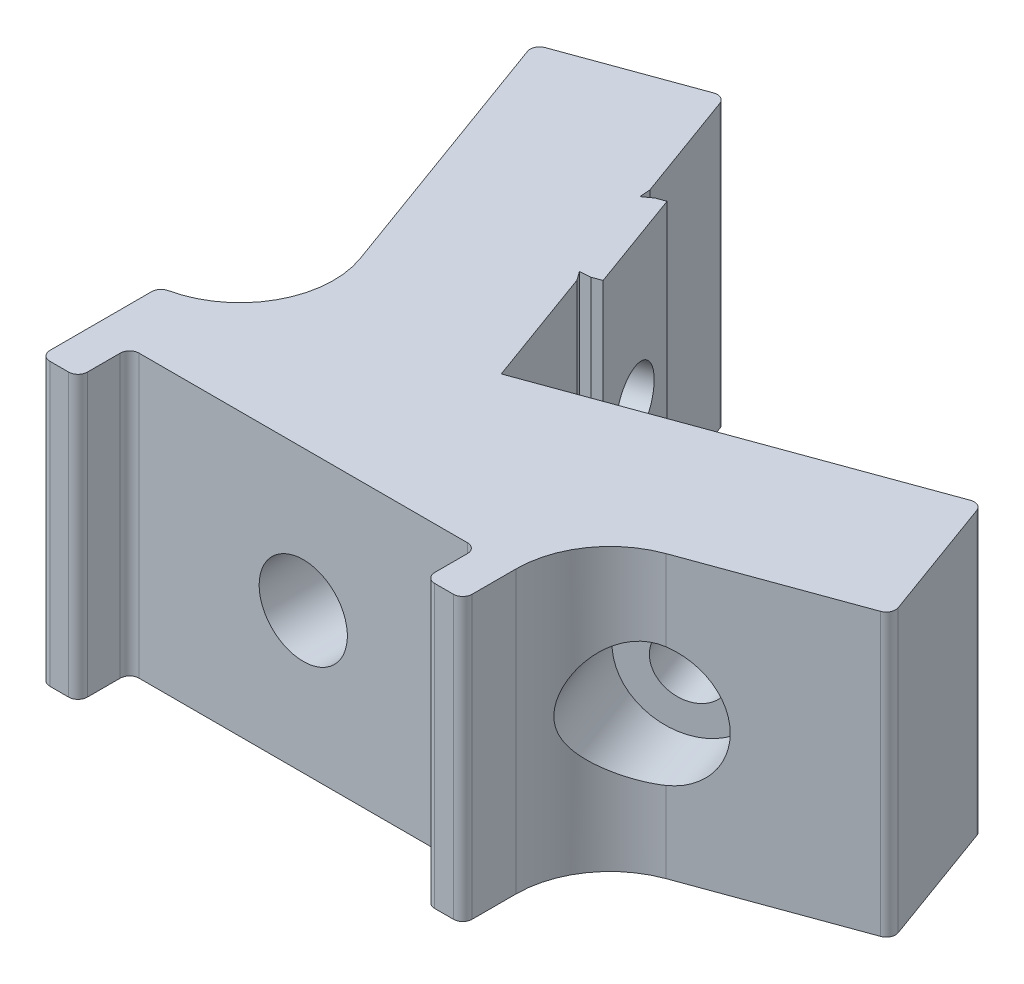
from build123d import *

# Parameters (mm, degrees)
BOSS_EXTRUDE1_DEPTH                                 = 15
SKETCH4_R                                           = 2.35
CUT_EXTRUDE3_DEPTH                                  = 6
CBORE_FOR_M3_HEX_SOCKET_HEAD_CAP_SCREW1_D           = 3.4
CBORE_FOR_M3_HEX_SOCKET_HEAD_CAP_SCREW1_CBORE_D     = 6.5
CBORE_FOR_M3_HEX_SOCKET_HEAD_CAP_SCREW1_CBORE_DEPTH = 3.4
CUT_EXTRUDE4_DEPTH                                  = 40.36183231
SKETCH2_R                                           = 3.25
CUT_EXTRUDE5_DEPTH                                  = 42.264373258
FILLET4_R                                           = 5
FILLET5_R                                           = 5
FILLET6_R                                           = 0.5
FILLET7_R                                           = 0.5
FILLET8_R                                           = 0.5
FILLET9_R                                           = 0.5
FILLET10_R                                          = 0.5
FILLET11_R                                          = 0.5
FILLET12_R                                          = 0.5
FILLET13_R                                          = 0.5
FILLET14_R                                          = 0.5
FILLET15_R                                          = 0.5
FILLET16_R                                          = 0.5


with BuildPart() as part:
    # Sketch1 → Boss-Extrude1 (new body)
    with BuildSketch(Plane(origin=(0, 0, 0), x_dir=(1, 0, 0), z_dir=(0, 1, 0))):
        Polygon((-23.760232958, -5.596615827), (-31.459597373, 15.557214047), (-23.942056406, 18.293375193), (-17.10165354, -0.500477222), (1.692198876, 6.339925644), (4.428360022, -1.177615322), (-7.712744083, -5.596615827), align=None)
        Polygon((-20.650889023, 11.882391084), (-21.496612382, 11.574572955), (-19.547097565, 6.218325016), (-18.701374206, 6.526143145), align=None)
        Polygon((-18.962744083, -5.596615827), (-23.760232958, -5.596615827), (-30.212744083, -5.596615827), (-30.212744083, -11.939309749), (-28.212744083, -11.939309749), (-28.212744083, -9.189582126), (-9.712744083, -9.189582126), (-9.712744083, -11.939309749), (-7.712744083, -11.939309749), (-7.712744083, -5.596615827), align=None)
    extrude(amount=BOSS_EXTRUDE1_DEPTH)

    # Sketch4 → Cut-Extrude3 (cut)
    with BuildSketch(Plane(origin=(0, 0, 9.189582126), x_dir=(-1, 0, 0), z_dir=(0, 0, -1))):
        with Locations((18.962744083, 7.5)):
            Circle(SKETCH4_R)
    extrude(amount=CUT_EXTRUDE3_DEPTH, mode=Mode.SUBTRACT)

    # CBORE for M3 Hex Socket Head Cap Screw1 (through all)
    with Locations(Plane(origin=(-22.779531346, 0, 8.291071361), x_dir=(0.34202014332566366, 0, 0.9396926207859102), z_dir=(-0.9396926207859103, 0, 0.3420201433256637))):
        with Locations((-15.378815242, 7.5)):
            CounterBoreHole(CBORE_FOR_M3_HEX_SOCKET_HEAD_CAP_SCREW1_D / 2, CBORE_FOR_M3_HEX_SOCKET_HEAD_CAP_SCREW1_CBORE_D / 2, CBORE_FOR_M3_HEX_SOCKET_HEAD_CAP_SCREW1_CBORE_DEPTH)

    # Sketch10 → CBORE for M3 Hex Socket Head Cap Screw2 (revolve, cut)
    with BuildSketch(Plane(origin=(-4.968566186, 7.5, 4.597816755), x_dir=(0.9396926207859094, 0, -0.34202014332566627), z_dir=(0, 1, 0))):
        Polygon((0, 0), (0, 30.571150439), (1.7, 30.571150439), (1.7, 3.4), (3.25, 3.4), (3.25, 0), align=None)
    revolve(axis=Axis((-2.796738275, 7.5, 10.564864897), (-0.34202014332566627, 0, -0.9396926207859094)), mode=Mode.SUBTRACT)

    # Sketch11 → Cut-Extrude4 (cut, through all)
    with BuildSketch(Plane(origin=(0, 15, 0), x_dir=(1, 0, 0), z_dir=(0, 1, 0))):
        Polygon((-21.633420439, 11.950450003), (-21.589873913, 11.374572955), (-21.120735333, 11.711381012), (-21.496612382, 11.574572955), align=None)
    cut_extrude4 = extrude(amount=-CUT_EXTRUDE4_DEPTH, mode=Mode.SUBTRACT)

    # Mirror1: Cut-Extrude4 across plane
    add(cut_extrude4.mirror(Plane(origin=(-5.259864593, 0, -14.4513592), x_dir=(0.9396926207859102, 0, -0.3420201433256638), z_dir=(-0.3420201433256638, 0, -0.9396926207859102))), mode=Mode.SUBTRACT)

    # Sketch2 → Cut-Extrude5 (cut, through all)
    with BuildSketch(Plane(origin=(0.896497987, 0, 2.463107975), x_dir=(0.9396926207859094, 0, -0.34202014332566627), z_dir=(0.34202014332566627, 0, 0.9396926207859094))):
        with Locations((-6.241470926, 7.5)):
            Circle(SKETCH2_R)
    extrude(amount=CUT_EXTRUDE5_DEPTH, mode=Mode.SUBTRACT)

    # Fillet4
    # the kernel refuses this fillet: 5 mm, written as the material it adds along each edge
    with BuildSketch(Plane(origin=(-23.760232958, 0, 5.596615827), x_dir=(-0.34202014332566355, 0, -0.9396926207859103), z_dir=(0, 1, 0))) as fillet4_piece_1:
        with BuildLine():
            CenterArc((7.092503292, 5), FILLET4_R, 167.720815182, 102.279184818)
            Line((2.20688878, 6.06337709), (2.10917649, 6.084644632))
            ThreePointArc((2.10917649, 6.084644632), (1.009475128, 3.065890559), (-0.093969262, 0.034202014))
            Line((-0.093969262, 0.034202014), (0, -0.1))
            Line((0, -0.1), (7.092503292, -0.1))
            Line((7.092503292, -0.1), (7.092503292, 0))
        make_face()
    extrude(amount=15)

    # Fillet5
    # the kernel refuses this fillet: 5 mm, written as the material it adds along each edge
    with BuildSketch(Plane(origin=(-7.712744083, 0.173725541, 5.596615827), x_dir=(0, 0, 1), z_dir=(0, 1, 0))) as fillet5_piece_1_section:
        with BuildLine():
            CenterArc((FILLET5_R * 0.70020753821, FILLET5_R), FILLET5_R, 200, 70)
            Line((-FILLET5_R * 0.239485082576, FILLET5_R * 0.657979856674), (0, 0))
            Line((0, 0), (FILLET5_R * 0.70020753821, 0))
        make_face()
    fillet5_piece_1 = extrude(amount=14.826274459, mode=Mode.PRIVATE)
    fillet5_piece_1 = fillet5_piece_1 - Plane(origin=(-4.162007445, 7.5, 6.813818681), x_dir=(0.9396926207859094, 0, -0.34202014332566627), z_dir=(-0.34202014332566627, 0, -0.9396926207859094)) * Cylinder(3.25, 44, mode=Mode.PRIVATE)
    add(fillet5_piece_1)
    with BuildSketch(Plane(origin=(-7.712744083, 0, 5.596615827), x_dir=(0, 0, 1), z_dir=(0, 1, 0))) as fillet5_piece_2_section:
        with BuildLine():
            CenterArc((FILLET5_R * 0.70020753821, FILLET5_R), FILLET5_R, 200, 70)
            Line((-FILLET5_R * 0.239485082576, FILLET5_R * 0.657979856674), (0, 0))
            Line((0, 0), (FILLET5_R * 0.70020753821, 0))
        make_face()
    fillet5_piece_2 = extrude(amount=14.826274459, mode=Mode.PRIVATE)
    fillet5_piece_2 = fillet5_piece_2 - Plane(origin=(-4.162007445, 7.5, 6.813818681), x_dir=(0.9396926207859094, 0, -0.34202014332566627), z_dir=(-0.34202014332566627, 0, -0.9396926207859094)) * Cylinder(3.25, 44, mode=Mode.PRIVATE)
    add(fillet5_piece_2)

    # Fillet6
    fillet6_edges = [part.edges().sort_by_distance(p)[0] for p in [
        (-28.212744083, 7.5, 9.189582126),
    ]]
    fillet(fillet6_edges, radius=FILLET6_R)

    # Fillet7
    fillet7_edges = [part.edges().sort_by_distance(p)[0] for p in [
        (-9.712744083, 7.5, 9.189582126),
    ]]
    fillet(fillet7_edges, radius=FILLET7_R)

    # Fillet8
    fillet8_edges = [part.edges().sort_by_distance(p)[0] for p in [
        (-28.212744083, 7.5, 11.939309749),
    ]]
    fillet(fillet8_edges, radius=FILLET8_R)

    # Fillet9
    fillet9_edges = [part.edges().sort_by_distance(p)[0] for p in [
        (-9.712744083, 7.5, 11.939309749),
    ]]
    fillet(fillet9_edges, radius=FILLET9_R)

    # Fillet10
    fillet10_edges = [part.edges().sort_by_distance(p)[0] for p in [
        (-30.212744083, 7.5, 11.939309749),
    ]]
    fillet(fillet10_edges, radius=FILLET10_R)

    # Fillet11
    fillet11_edges = [part.edges().sort_by_distance(p)[0] for p in [
        (-7.712744083, 7.5, 11.939309749),
    ]]
    fillet(fillet11_edges, radius=FILLET11_R)

    # Fillet12
    fillet12_edges = [part.edges().sort_by_distance(p)[0] for p in [
        (4.428360022, 7.5, 1.177615322),
    ]]
    fillet(fillet12_edges, radius=FILLET12_R)

    # Fillet13
    fillet13_edges = [part.edges().sort_by_distance(p)[0] for p in [
        (1.692198876, 7.5, -6.339925644),
    ]]
    fillet(fillet13_edges, radius=FILLET13_R)

    # Fillet14
    fillet14_edges = [part.edges().sort_by_distance(p)[0] for p in [
        (-23.942056406, 7.5, -18.293375193),
    ]]
    fillet(fillet14_edges, radius=FILLET14_R)

    # Fillet15
    fillet15_edges = [part.edges().sort_by_distance(p)[0] for p in [
        (-31.459597373, 7.5, -15.557214047),
    ]]
    fillet(fillet15_edges, radius=FILLET15_R)

    # Fillet16
    fillet16_edges = [part.edges().sort_by_distance(p)[0] for p in [
        (-30.212744083, 7.5, 5.596615827),
    ]]
    fillet(fillet16_edges, radius=FILLET16_R)


solid = part.part
